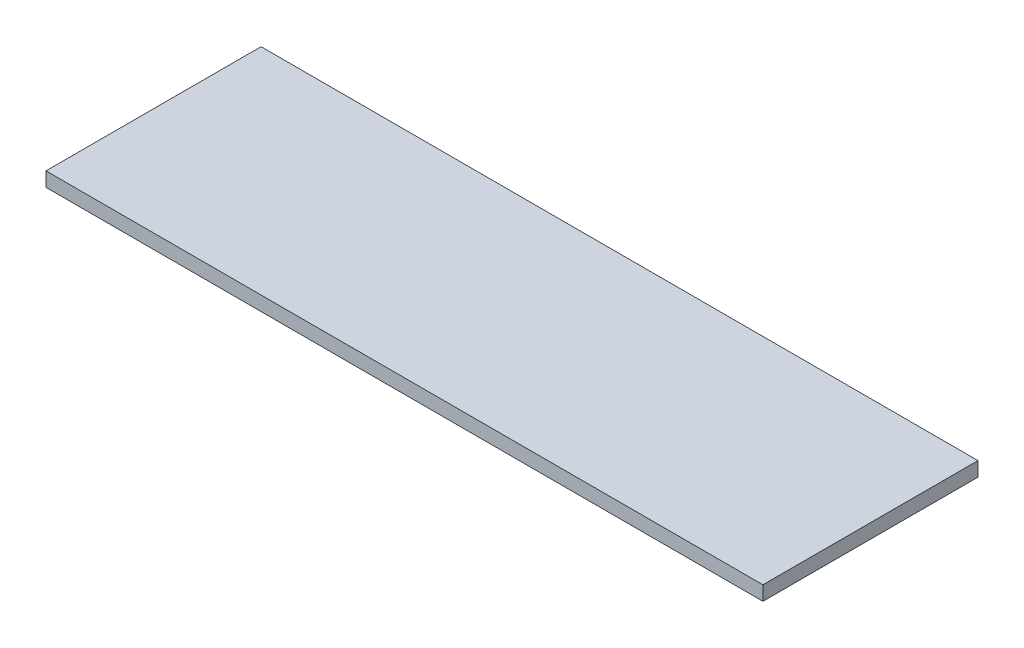
from build123d import *

# Parameters (mm, degrees)
SKETCH1_W           = 150
SKETCH1_H           = 45
BOSS_EXTRUDE1_DEPTH = 3


with BuildPart() as part:
    # Sketch1 → Boss-Extrude1 (new body)
    with BuildSketch(Plane(origin=(0, 0, 0), x_dir=(1, 0, 0), z_dir=(0, 1, 0))):
        Rectangle(SKETCH1_W, SKETCH1_H)
    extrude(amount=BOSS_EXTRUDE1_DEPTH)


solid = part.part
